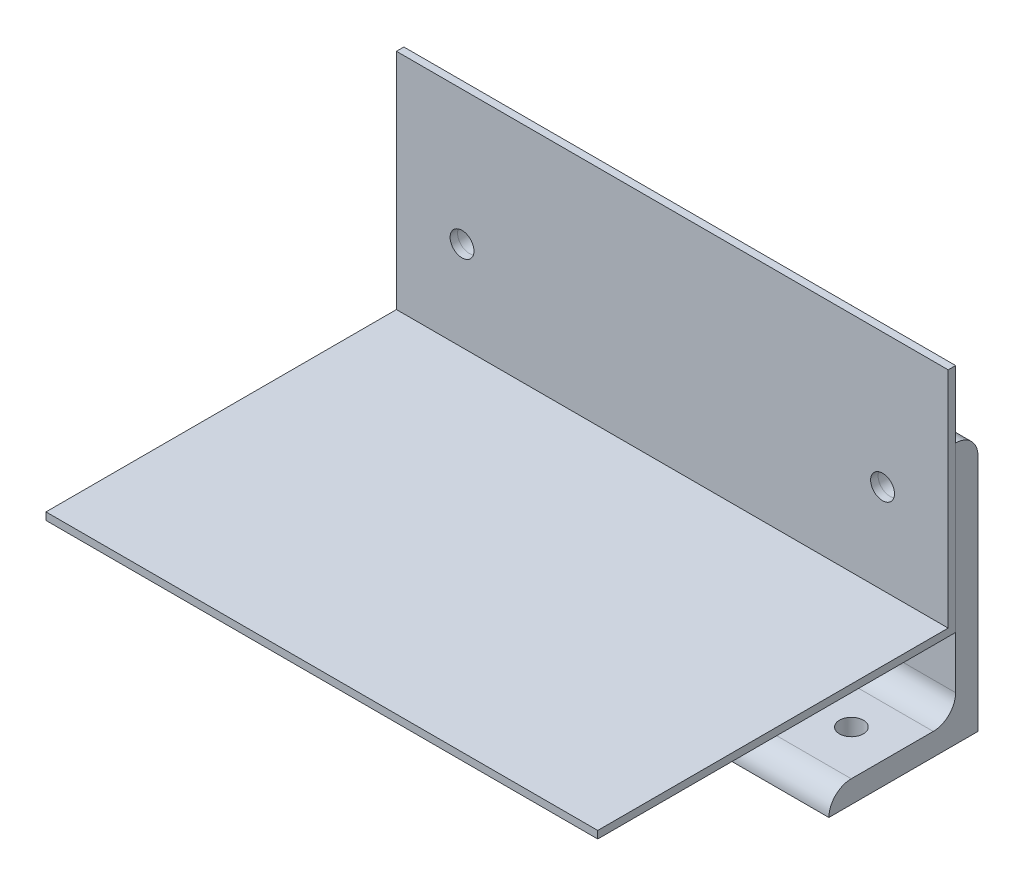
from build123d import *

# Parameters (mm, degrees)
EXTRUDE_1_DEPTH     = 74
SKETCH_2_R          = 1.6
CUT_EXTRUDE_1_DEPTH = 13
SKETCH2_W           = 74
SKETCH2_H           = 32
BOSS_EXTRUDE1_DEPTH = 3
SKETCH3_W           = 74
SKETCH3_H           = 20
SKETCH3_R           = 1.6
BOSS_EXTRUDE2_DEPTH = 3
SKETCH5_R           = 1.6
CUT_EXTRUDE1_DEPTH  = 3
FILLET3_R           = 3
FILLET5_R           = 3
FILLET6_R           = 3


with BuildPart() as part:
    # Эскиз1 → Бобышка-Вытянуть1 (new body)
    with BuildSketch(Plane(origin=(0, 0, 0), x_dir=(0, 0, -1), z_dir=(1, 0, 0))):
        Polygon((0, 0), (-48, 0), (-48, 1), (-1, 1), (-1, 31), (0, 31), align=None)
    extrude(amount=EXTRUDE_1_DEPTH)

    # Эскиз2 → Вырез-Вытянуть1 (cut)
    with BuildSketch(Plane(origin=(0, 0, 0), x_dir=(-1, 0, 0), z_dir=(0, 0, -1))):
        with Locations((-65.2, 13)):
            Circle(SKETCH_2_R)
        with Locations((-8.8, 13)):
            Circle(SKETCH_2_R)
    extrude(amount=-CUT_EXTRUDE_1_DEPTH, mode=Mode.SUBTRACT)


with BuildPart() as body_2:
    # Sketch2 → Boss-Extrude1 (new body)
    with BuildSketch(Plane(origin=(0, 0, 0), x_dir=(-1, 0, 0), z_dir=(0, 0, -1))):
        with Locations((-37, 6)):
            Rectangle(SKETCH2_W, SKETCH2_H)
    extrude(amount=BOSS_EXTRUDE1_DEPTH)

    # Sketch3 → Boss-Extrude2 (add)
    with BuildSketch(Plane.XZ.offset(10)):
        with Locations((37, 7)):
            Rectangle(SKETCH3_W, SKETCH3_H)
        with Locations((6, 7.979709157)):
            Circle(SKETCH3_R, mode=Mode.SUBTRACT)
        with Locations((68, 7.979709157)):
            Circle(SKETCH3_R, mode=Mode.SUBTRACT)
    extrude(amount=BOSS_EXTRUDE2_DEPTH)

    # Sketch5 → Cut-Extrude1 (cut)
    with BuildSketch(Plane(origin=(0, 0, -3), x_dir=(-1, 0, 0), z_dir=(0, 0, -1))):
        with Locations((-65.2, 13)):
            Circle(SKETCH5_R)
        with Locations((-8.8, 13)):
            Circle(SKETCH5_R)
    extrude(amount=-CUT_EXTRUDE1_DEPTH, mode=Mode.SUBTRACT)

    # Fillet3
    fillet3_edges = [body_2.edges().sort_by_distance(p)[0] for p in [
        (37, 22, -3),
    ]]
    fillet(fillet3_edges, radius=FILLET3_R - 0.0001)  # a hair under: the kernel refuses the full size

    # Fillet5
    fillet5_edges = [body_2.edges().sort_by_distance(p)[0] for p in [
        (37, -10, 17),
    ]]
    fillet(fillet5_edges, radius=FILLET5_R - 0.0001)  # a hair under: the kernel refuses the full size

    # Fillet6
    fillet6_edges = [body_2.edges().sort_by_distance(p)[0] for p in [
        (37, -10, 0),
    ]]
    fillet(fillet6_edges, radius=FILLET6_R)


solid = Compound([part.part, body_2.part])
